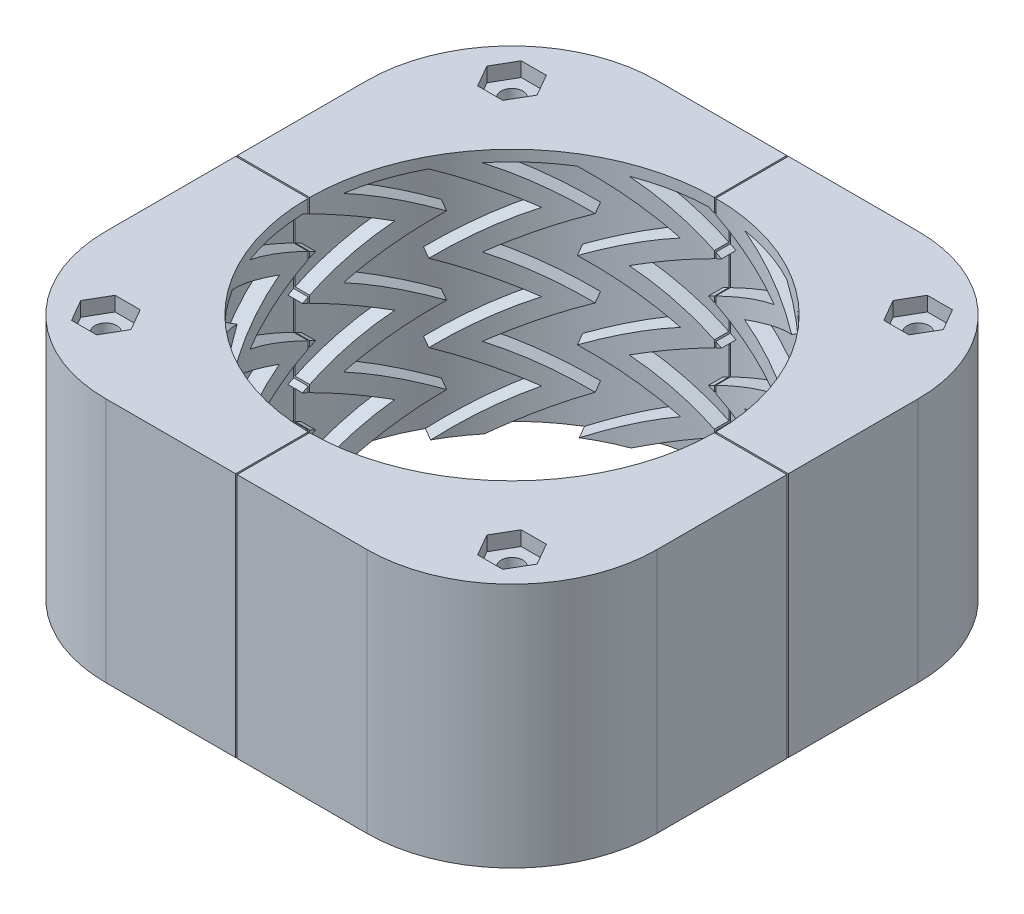
from build123d import *

# Parameters (mm, degrees)
SKETCH_2_W                = 76
SKETCH_2_H                = 76
EXTRUDE_1_DEPTH           = 42
CUT_EXTRUDE_1_REACH       = 66.684
SKETCH_4_R                = 1.5
FILLET_1_R                = 20
CUT_EXTRUDE_3_DEPTH       = 8
PATTERN_CIRCULAR_1_COUNT  = 12
SKETCH_8_W                = 2
SKETCH_8_H                = 32.5
CUT_EXTRUDE_5_DEPTH       = 64.64597395
SKETCH_11_R               = 1.5
CUT_EXTRUDE_6_DEPTH       = 69.20557162
CUT_EXTRUDE_7_DEPTH       = 2
CUT_EXTRUDE_8_DEPTH       = 2
CUT_REVOLVE_21_ANGLE      = 359.999
CUT_EXTRUDE_10_DEPTH      = 69.20557162
CUT_EXTRUDE_10_DEPTH_BACK = 69.20557162
SKETCH_16_W               = 76.966566094
SKETCH_16_H               = 13.585884517


with BuildPart() as part:
    # Эскиз2 → Бобышка-Вытянуть1 (new body)
    with BuildSketch(Plane(origin=(0, 0, 0), x_dir=(1, 0, 0), z_dir=(0, 1, 0))):
        Rectangle(SKETCH_2_W, SKETCH_2_H)
    extrude(amount=EXTRUDE_1_DEPTH)

    # Эскиз3 → Вырез-Повернуть1 (revolve, cut)
    with BuildSketch(Plane(origin=(0, 0, 0), x_dir=(0, 0, -1), z_dir=(1, 0, 0))):
        Polygon((0, 42), (-28, 42), (-28, 8), (-23, 8), (-21, 6), (0, 6), align=None)
    revolve(axis=Axis((0, 6, 0), (0, 1, 0)), mode=Mode.SUBTRACT)

    # Эскиз4 → Вырез-Вытянуть1 (cut, up to next)
    with BuildSketch(Plane(origin=(0, 6, 0), x_dir=(1, 0, 0), z_dir=(0, 1, 0)), mode=Mode.PRIVATE) as cut_extrude_1_sk1:
        Circle(SKETCH_4_R)
    cut_extrude_1_tool1 = extrude(cut_extrude_1_sk1.sketch, amount=-CUT_EXTRUDE_1_REACH, mode=Mode.PRIVATE) & part.part
    add(cut_extrude_1_tool1.solids().sort_by_distance((0, 6, 0))[0], mode=Mode.SUBTRACT)

    # Скругление1
    fillet_1_edges = [part.edges().sort_by_distance(p)[0] for p in [
        (-38, 21, 38),
        (-38, 21, -38),
        (38, 21, -38),
        (38, 21, 38),
    ]]
    fillet(fillet_1_edges, radius=FILLET_1_R)

    # Эскиз7 → Вырез-Вытянуть3 (cut)
    with BuildSketch(Plane(origin=(23, 0, 0), x_dir=(0, 0, -1), z_dir=(1, 0, 0))):
        Polygon((10, 40.5), (0.899322945, 40.5), (-10, 35.166666667), (0.899322945, 29.833333333), (-10, 24.5), (0.899322945, 19.166666667), (-10, 13.833333333), (0.899322945, 8), (10, 8), (-0.899322945, 13.833333333), (10, 19.166666667), (-0.899322945, 24.5), (10, 29.833333333), (-0.899322945, 35.166666667), align=None)
    cut_extrude_3 = extrude(amount=CUT_EXTRUDE_3_DEPTH, mode=Mode.SUBTRACT)

    # Круговой массив1: Вырез-Вытянуть3 ×12 about axis
    pattern_circular_1_axis = Axis((0, 8, 0), (0, -1, 0))
    for i in range(1, PATTERN_CIRCULAR_1_COUNT):
        add(cut_extrude_3.rotate(pattern_circular_1_axis, i * 360 / PATTERN_CIRCULAR_1_COUNT), mode=Mode.SUBTRACT)

    # Эскиз8 → Повернуть1 (revolve)
    with BuildSketch(Plane(origin=(0, 0, 0), x_dir=(0, 0, -1), z_dir=(1, 0, 0))):
        with Locations((-31, 24.25)):
            Rectangle(SKETCH_8_W, SKETCH_8_H)
    revolve(axis=Axis((0, 47.507626588, 0), (0, -1, 0)))

    # Эскиз9 → Вырез-Вытянуть5 (cut, through all)
    with BuildSketch(Plane(origin=(0, 7.9, 0), x_dir=(1, 0, 0), z_dir=(0, 1, 0))):
        Polygon((-0.1, 40.898765892), (-0.1, 0.1), (-42.88831206, 0.1), (-42.88831206, -0.1), (-0.1, -0.1), (-0.1, -40.898765892), (0.1, -40.898765892), (0.1, -0.1), (42.798076052, -0.1), (42.798076052, 0.1), (0.1, 0.1), (0.1, 40.898765892), align=None)
    extrude(amount=CUT_EXTRUDE_5_DEPTH, mode=Mode.SUBTRACT)

    # Эскиз10 → Вырез-Повернуть3 (revolve, cut)
    with BuildSketch(Plane(origin=(0, 0, 0), x_dir=(0, 0, -1), z_dir=(1, 0, 0))):
        Polygon((-45.816798386, 8.1), (-45.816798386, 7.9), (-35.9, 7.9), (-35.9, 9.9), (-32.1, 9.9), (-32.1, 7.9), (-27.999821428, 7.9), (-27.999821428, 8.1), (-31.9, 8.1), (-31.9, 10.1), (-36.1, 10.1), (-36.1, 8.1), align=None)
    revolve(axis=Axis((0, 46.355020879, 0), (0, -1, 0)), mode=Mode.SUBTRACT)


with BuildPart() as cut_revolve_3_piece_1:
    # of the separate pieces the step leaves, piece 1, a body of its own (cut_revolve_3_pieces)
    add(part.part.solids().sort_by_distance((18, 0, 38))[0])


with BuildPart() as cut_revolve_3_piece_2:
    # of the separate pieces the step leaves, piece 2, a body of its own (cut_revolve_3_pieces)
    add(part.part.solids().sort_by_distance((18, 8.1, 38))[0])


with BuildPart() as cut_revolve_3_piece_3:
    # of the separate pieces the step leaves, piece 3, a body of its own (cut_revolve_3_pieces)
    add(part.part.solids().sort_by_distance((-38, 8.1, -18))[0])


with BuildPart() as cut_revolve_3_piece_4:
    # of the separate pieces the step leaves, piece 4, a body of its own (cut_revolve_3_pieces)
    add(part.part.solids().sort_by_distance((38, 8.1, -18))[0])


with BuildPart() as cut_revolve_3_piece_5:
    # of the separate pieces the step leaves, piece 5, a body of its own (cut_revolve_3_pieces)
    add(part.part.solids().sort_by_distance((-18, 8.1, 38))[0])


with BuildPart() as cut_extrude_6_tool:
    # Эскиз11 → Вырез-Вытянуть6 (new, through all)
    with BuildSketch(Plane(origin=(0, 0, 0), x_dir=(1, 0, 0), z_dir=(0, 1, 0))):
        with Locations((-28, 28)):
            Circle(SKETCH_11_R)
        with Locations((28, 28)):
            Circle(SKETCH_11_R)
        with Locations((28, -28)):
            Circle(SKETCH_11_R)
        with Locations((-28, -28)):
            Circle(SKETCH_11_R)
    extrude(amount=CUT_EXTRUDE_6_DEPTH)


with BuildPart() as cut_revolve_3_piece_1_1:
    add(cut_revolve_3_piece_1.part)

    # Вырез-Вытянуть6: cut by cut_extrude_6_tool
    add(cut_extrude_6_tool.part, mode=Mode.SUBTRACT)

    # Эскиз12 → Вырез-Вытянуть7 (cut)
    with BuildSketch(Plane(origin=(0, 0, 0), x_dir=(1, 0, 0), z_dir=(0, 1, 0))):
        Polygon((-29.732050808, -31), (-26.267949192, -31), (-24.535898385, -28), (-26.267949192, -25), (-29.732050808, -25), (-31.464101615, -28), align=None)
        Polygon((26.267949192, -31), (29.732050808, -31), (31.464101615, -28), (29.732050808, -25), (26.267949192, -25), (24.535898385, -28), align=None)
        Polygon((26.267949192, 25), (29.732050808, 25), (31.464101615, 28), (29.732050808, 31), (26.267949192, 31), (24.535898385, 28), align=None)
        Polygon((-29.732050808, 25), (-26.267949192, 25), (-24.535898385, 28), (-26.267949192, 31), (-29.732050808, 31), (-31.464101615, 28), align=None)
        Polygon((-1.732050808, -3), (1.732050808, -3), (3.464101615, 0), (1.732050808, 3), (-1.732050808, 3), (-3.464101615, 0), align=None)
    extrude(amount=CUT_EXTRUDE_7_DEPTH, mode=Mode.SUBTRACT)

    # Эскиз10<6> → Вырез-Повернуть21 (revolve, cut)
    with BuildSketch(Plane(origin=(0, 0, 0), x_dir=(0, 0, -1), z_dir=(1, 0, 0))):
        Polygon((0, 8.1), (-31.9, 8.1), (-31.9, 10.1), (-36.1, 10.1), (-36.1, 8.1), (-45.816798386, 8.1), (-45.816798386, -6.223292247), (0, -6.223292247), align=None)
    revolve(axis=Axis((0, 46.355020879, 0), (0, -1, 0)), revolution_arc=CUT_REVOLVE_21_ANGLE, mode=Mode.SUBTRACT)

    # Эскиз16 → Вырез-Вытянуть10 (cut, two sides: drawn at the far end of the back side and taken through both)
    with BuildSketch(Plane(origin=(0, 0, 0), x_dir=(0, 0, -1), z_dir=(1, 0, 0)).offset(-CUT_EXTRUDE_10_DEPTH_BACK)):
        with Locations((0.483283047, 1.307057741)):
            Rectangle(SKETCH_16_W, SKETCH_16_H)
    extrude(amount=CUT_EXTRUDE_10_DEPTH + CUT_EXTRUDE_10_DEPTH_BACK, mode=Mode.SUBTRACT)


with BuildPart() as cut_revolve_3_piece_2_1:
    add(cut_revolve_3_piece_2.part)

    # Вырез-Вытянуть6: cut by cut_extrude_6_tool
    add(cut_extrude_6_tool.part, mode=Mode.SUBTRACT)


with BuildPart() as cut_revolve_3_piece_3_1:
    add(cut_revolve_3_piece_3.part)

    # Вырез-Вытянуть6: cut by cut_extrude_6_tool
    add(cut_extrude_6_tool.part, mode=Mode.SUBTRACT)


with BuildPart() as cut_revolve_3_piece_4_1:
    add(cut_revolve_3_piece_4.part)

    # Вырез-Вытянуть6: cut by cut_extrude_6_tool
    add(cut_extrude_6_tool.part, mode=Mode.SUBTRACT)


with BuildPart() as cut_revolve_3_piece_5_1:
    add(cut_revolve_3_piece_5.part)

    # Вырез-Вытянуть6: cut by cut_extrude_6_tool
    add(cut_extrude_6_tool.part, mode=Mode.SUBTRACT)


with BuildPart() as cut_extrude_8_tool:
    # Эскиз13 → Вырез-Вытянуть8 (new body)
    with BuildSketch(Plane(origin=(0, 42, 0), x_dir=(1, 0, 0), z_dir=(0, 1, 0))):
        Polygon((-29.732050808, 31), (-31.464101615, 28), (-29.732050808, 25), (-26.267949192, 25), (-24.535898385, 28), (-26.267949192, 31), align=None)
        Polygon((26.267949192, 31), (24.535898385, 28), (26.267949192, 25), (29.732050808, 25), (31.464101615, 28), (29.732050808, 31), align=None)
        Polygon((26.267949192, -25), (24.535898385, -28), (26.267949192, -31), (29.732050808, -31), (31.464101615, -28), (29.732050808, -25), align=None)
        Polygon((-29.732050808, -25), (-31.464101615, -28), (-29.732050808, -31), (-26.267949192, -31), (-24.535898385, -28), (-26.267949192, -25), align=None)
    extrude(amount=-CUT_EXTRUDE_8_DEPTH)


with BuildPart() as cut_revolve_3_piece_2_2:
    add(cut_revolve_3_piece_2_1.part)

    # Вырез-Вытянуть8: cut by cut_extrude_8_tool
    add(cut_extrude_8_tool.part, mode=Mode.SUBTRACT)


with BuildPart() as cut_revolve_3_piece_3_2:
    add(cut_revolve_3_piece_3_1.part)

    # Вырез-Вытянуть8: cut by cut_extrude_8_tool
    add(cut_extrude_8_tool.part, mode=Mode.SUBTRACT)


with BuildPart() as cut_revolve_3_piece_4_2:
    add(cut_revolve_3_piece_4_1.part)

    # Вырез-Вытянуть8: cut by cut_extrude_8_tool
    add(cut_extrude_8_tool.part, mode=Mode.SUBTRACT)


with BuildPart() as cut_revolve_3_piece_5_2:
    add(cut_revolve_3_piece_5_1.part)

    # Вырез-Вытянуть8: cut by cut_extrude_8_tool
    add(cut_extrude_8_tool.part, mode=Mode.SUBTRACT)


solid = Compound([cut_revolve_3_piece_2_2.part, cut_revolve_3_piece_3_2.part, cut_revolve_3_piece_4_2.part, cut_revolve_3_piece_5_2.part])
